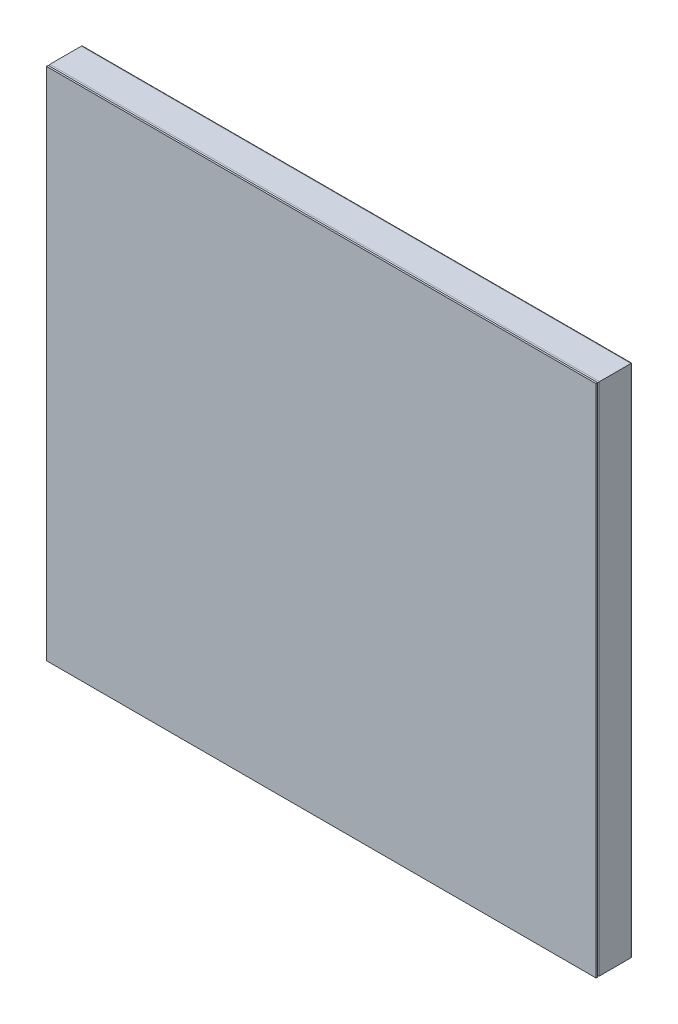
from build123d import *

# Parameters (mm, degrees)
SKETCH_1_W                 = 630
SKETCH_1_H                 = 590
SM_BASE_FLANGE_1_DEPTH     = 2
SKETCH_4_W                 = 630
SKETCH_4_H                 = 590
SKETCH_4_W_2               = 550
SKETCH_4_H_2               = 510
EXTRUDE_1_DEPTH            = 40
SPLIT_START                = 229
SPLIT_BODIES_1_OUTLINE_W   = 418.911434438
SPLIT_BODIES_1_OUTLINE_H   = 40
SPLIT_BODIES_1_DEPTH       = 864
SPLIT_START_2              = 675.286976033
SPLIT_BODIES_1_2_OUTLINE_W = 447.088565562
SPLIT_BODIES_1_2_OUTLINE_H = 40
SPLIT_BODIES_1_2_DEPTH     = 417.713023967
SPLIT_START_3              = -20
SPLIT_BODIES_1_3_DEPTH     = 40
SPLIT_BODIES_1_4_DEPTH     = 40
SPLIT_BODIES_1_5_DEPTH     = 40
CUT_EXTRUDE_1_DEPTH        = 865.060183089
CUT_EXTRUDE_1_DEPTH_BACK   = 865.060183089
SKETCH_6_W                 = 32
SKETCH_6_H                 = 32
CUT_EXTRUDE_2_DEPTH        = 865.060183089
CUT_EXTRUDE_2_DEPTH_BACK   = 865.060183089
SKETCH_7_W                 = 32
SKETCH_7_H                 = 32
CUT_EXTRUDE_3_DEPTH        = 865.060183089
CUT_EXTRUDE_3_DEPTH_BACK   = 865.060183089
SKETCH_8_W                 = 32
SKETCH_8_H                 = 32
CUT_EXTRUDE_4_DEPTH        = 865.060183089
CUT_EXTRUDE_4_DEPTH_BACK   = 865.060183089
SKETCH_9_W                 = 32
SKETCH_9_H                 = 32
FILLET_1_R                 = 2
FILLET_2_R                 = 1
FILLET_3_R                 = 2
FILLET_4_R                 = 1
FILLET_5_R                 = 2
FILLET_6_R                 = 1
FILLET_7_R                 = 2
FILLET_8_R                 = 1


with BuildPart() as part:
    # 基体-法兰1: sheet metal written as solids
    # Sketch 1 → 基体-法兰1 (new body)
    with BuildSketch(Plane.XY.offset(22)):
        with Locations((1210, -275)):
            Rectangle(SKETCH_1_W, SKETCH_1_H)
    extrude(amount=-SM_BASE_FLANGE_1_DEPTH)


with BuildPart() as body_2:
    # 草图4 → 凸台-拉伸1 (new body)
    with BuildSketch(Plane(origin=(0, 0, 20), x_dir=(-1, 0, 0), z_dir=(0, 0, -1))):
        with Locations((-1210, -275)):
            Rectangle(SKETCH_4_W, SKETCH_4_H)
        with Locations((-1210, -275)):
            Rectangle(SKETCH_4_W_2, SKETCH_4_H_2, mode=Mode.SUBTRACT)
    extrude(amount=EXTRUDE_1_DEPTH)

    # Split Bodies 1: read off the stored shape, not the designer's step
    # Split Bodies 1 outline → Split Bodies 1 (cut)
    with BuildSketch(Plane(origin=(0, 0, 0), x_dir=(0.707106781186546, -0.707106781186549, 0), z_dir=(0.707106781186549, 0.707106781186546, 0)).offset(SPLIT_START)):
        with Locations((826.455717219, 0)):
            Rectangle(SPLIT_BODIES_1_OUTLINE_W, SPLIT_BODIES_1_OUTLINE_H)
    extrude(amount=SPLIT_BODIES_1_DEPTH, mode=Mode.SUBTRACT)

    # Split Bodies 1 2 outline → Split Bodies 1 2 (cut)
    with BuildSketch(Plane(origin=(0, 0, 0), x_dir=(0.707106781186546, -0.707106781186549, 0), z_dir=(0.707106781186549, 0.707106781186546, 0)).offset(SPLIT_START_2)):
        with Locations((1259.455717219, 0)):
            Rectangle(SPLIT_BODIES_1_2_OUTLINE_W, SPLIT_BODIES_1_2_OUTLINE_H)
    extrude(amount=SPLIT_BODIES_1_2_DEPTH, mode=Mode.SUBTRACT)

    # 草图6 → 切除-拉伸1 (cut, two sides: drawn at the far end of the back side and taken through both)
    with BuildSketch(Plane(origin=(1525, -570, 20), x_dir=(0, 0, 1), z_dir=(-1, 0, 0)).offset(-CUT_EXTRUDE_1_DEPTH_BACK)):
        with Locations((-20, 20)):
            Rectangle(SKETCH_6_W, SKETCH_6_H)
    extrude(amount=CUT_EXTRUDE_1_DEPTH + CUT_EXTRUDE_1_DEPTH_BACK, mode=Mode.SUBTRACT)

    # 圆角1
    fillet_1_edges = [body_2.edges().sort_by_distance(p)[0] for p in [
        (1210, -530, 20),
        (1210, -530, -20),
        (1210, -570, 20),
        (1210, -570, -20),
    ]]
    fillet(fillet_1_edges, radius=FILLET_1_R)

    # 圆角2
    fillet_2_edges = [body_2.edges().sort_by_distance(p)[0] for p in [
        (1210, -566, -16),
        (1210, -566, 16),
        (1210, -534, 16),
        (1210, -534, -16),
    ]]
    fillet(fillet_2_edges, radius=FILLET_2_R)


with BuildPart() as body_3:
    # Split Bodies 1 3 outline → Split Bodies 1 3 (new body)
    with BuildSketch(Plane.XY.offset(SPLIT_START_3)):
        Polygon((895, 20), (935, -20), (1485, -20), (1525, 20), align=None)
    extrude(amount=SPLIT_BODIES_1_3_DEPTH)

    # 草图9 → 切除-拉伸4 (cut, two sides: drawn at the far end of the back side and taken through both)
    with BuildSketch(Plane(origin=(895, 20, 20), x_dir=(0, 0, -1), z_dir=(1, 0, 0)).offset(-CUT_EXTRUDE_4_DEPTH_BACK)):
        with Locations((20, -20)):
            Rectangle(SKETCH_9_W, SKETCH_9_H)
    extrude(amount=CUT_EXTRUDE_4_DEPTH + CUT_EXTRUDE_4_DEPTH_BACK, mode=Mode.SUBTRACT)

    # 圆角7
    fillet_7_edges = [body_3.edges().sort_by_distance(p)[0] for p in [
        (1210, -20, 20),
        (1210, -20, -20),
        (1210, 20, 20),
        (1210, 20, -20),
    ]]
    fillet(fillet_7_edges, radius=FILLET_7_R)

    # 圆角8
    fillet_8_edges = [body_3.edges().sort_by_distance(p)[0] for p in [
        (1210, 16, -16),
        (1210, 16, 16),
        (1210, -16, 16),
        (1210, -16, -16),
    ]]
    fillet(fillet_8_edges, radius=FILLET_8_R)


with BuildPart() as body_4:
    # Split Bodies 1 4 outline → Split Bodies 1 4 (new body)
    with BuildSketch(Plane.XY.offset(SPLIT_START_3)):
        Polygon((1485, -530), (1525, -570), (1525, 20), (1485, -20), align=None)
    extrude(amount=SPLIT_BODIES_1_4_DEPTH)

    # 草图7 → 切除-拉伸2 (cut, two sides: drawn at the far end of the back side and taken through both)
    with BuildSketch(Plane(origin=(1525, 20, 20), x_dir=(-1, 0, 0), z_dir=(0, -1, 0)).offset(-CUT_EXTRUDE_2_DEPTH_BACK)):
        with Locations((20, 20)):
            Rectangle(SKETCH_7_W, SKETCH_7_H)
    extrude(amount=CUT_EXTRUDE_2_DEPTH + CUT_EXTRUDE_2_DEPTH_BACK, mode=Mode.SUBTRACT)

    # 圆角3
    fillet_3_edges = [body_4.edges().sort_by_distance(p)[0] for p in [
        (1485, -275, 20),
        (1485, -275, -20),
        (1525, -275, 20),
        (1525, -275, -20),
    ]]
    fillet(fillet_3_edges, radius=FILLET_3_R)

    # 圆角4
    fillet_4_edges = [body_4.edges().sort_by_distance(p)[0] for p in [
        (1521, -275, -16),
        (1521, -275, 16),
        (1489, -275, 16),
        (1489, -275, -16),
    ]]
    fillet(fillet_4_edges, radius=FILLET_4_R)


with BuildPart() as body_5:
    # Split Bodies 1 5 outline → Split Bodies 1 5 (new body)
    with BuildSketch(Plane.XY.offset(SPLIT_START_3)):
        Polygon((895, -570), (935, -530), (935, -20), (895, 20), align=None)
    extrude(amount=SPLIT_BODIES_1_5_DEPTH)

    # 草图8 → 切除-拉伸3 (cut, two sides: drawn at the far end of the back side and taken through both)
    with BuildSketch(Plane(origin=(895, -570, 20), x_dir=(1, 0, 0), z_dir=(0, 1, 0)).offset(-CUT_EXTRUDE_3_DEPTH_BACK)):
        with Locations((20, 20)):
            Rectangle(SKETCH_8_W, SKETCH_8_H)
    extrude(amount=CUT_EXTRUDE_3_DEPTH + CUT_EXTRUDE_3_DEPTH_BACK, mode=Mode.SUBTRACT)

    # 圆角5
    fillet_5_edges = [body_5.edges().sort_by_distance(p)[0] for p in [
        (935, -275, 20),
        (935, -275, -20),
        (895, -275, -20),
        (895, -275, 20),
    ]]
    fillet(fillet_5_edges, radius=FILLET_5_R)

    # 圆角6
    fillet_6_edges = [body_5.edges().sort_by_distance(p)[0] for p in [
        (899, -275, -16),
        (899, -275, 16),
        (931, -275, 16),
        (931, -275, -16),
    ]]
    fillet(fillet_6_edges, radius=FILLET_6_R)


solid = Compound([part.part, body_2.part, body_3.part, body_4.part, body_5.part])
